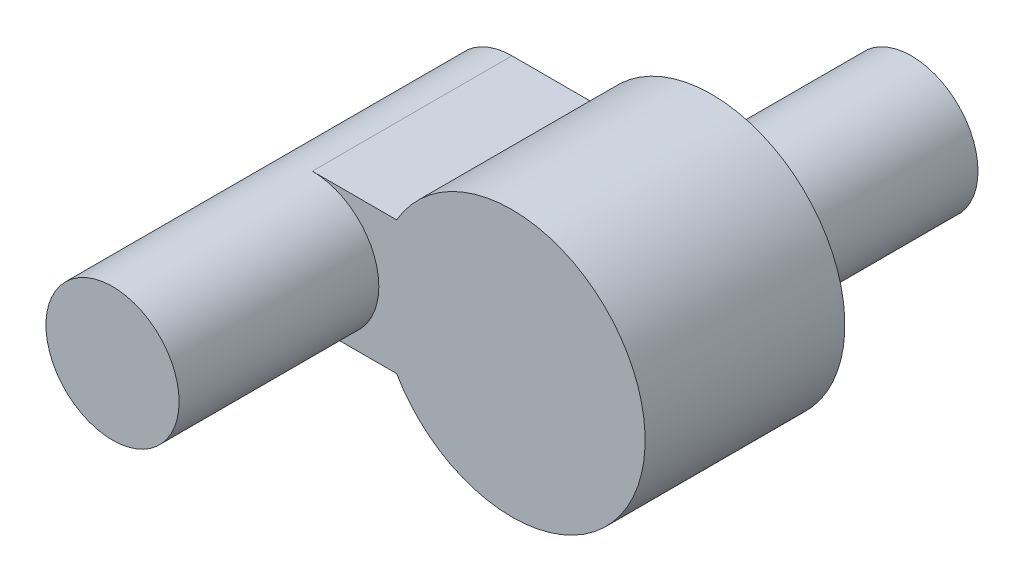
from build123d import *

# Parameters (mm, degrees)
BOSS_EXTRUDE1_DEPTH = 3
SKETCH2_R           = 1
BOSS_EXTRUDE2_DEPTH = 3
SKETCH3_R           = 1
BOSS_EXTRUDE3_DEPTH = 3


with BuildPart() as part:
    # Sketch1 → Boss-Extrude1 (new body)
    with BuildSketch(Plane.XY):
        with BuildLine():
            ThreePointArc((-7.470745652, 3.390391994), (-3.738694844, 4.390391994), (-7.470745652, 5.390391994))
            Line((-7.470745652, 5.390391994), (-8.738694844, 5.390391994))
            ThreePointArc((-8.738694844, 5.390391994), (-9.738694844, 4.390391994), (-8.738694844, 3.390391994))
            Line((-8.738694844, 3.390391994), (-7.470745652, 3.390391994))
        make_face()
    extrude(amount=BOSS_EXTRUDE1_DEPTH)

    # Sketch2 → Boss-Extrude2 (add)
    with BuildSketch(Plane.XY.offset(3)):
        with Locations((-8.738694844, 4.390391994)):
            Circle(SKETCH2_R)
    extrude(amount=BOSS_EXTRUDE2_DEPTH)

    # Sketch3 → Boss-Extrude3 (add)
    with BuildSketch(Plane(origin=(0, 0, 0), x_dir=(-1, 0, 0), z_dir=(0, 0, -1))):
        with Locations((5.738694844, 4.390391994)):
            Circle(SKETCH3_R)
    extrude(amount=BOSS_EXTRUDE3_DEPTH)


solid = part.part
